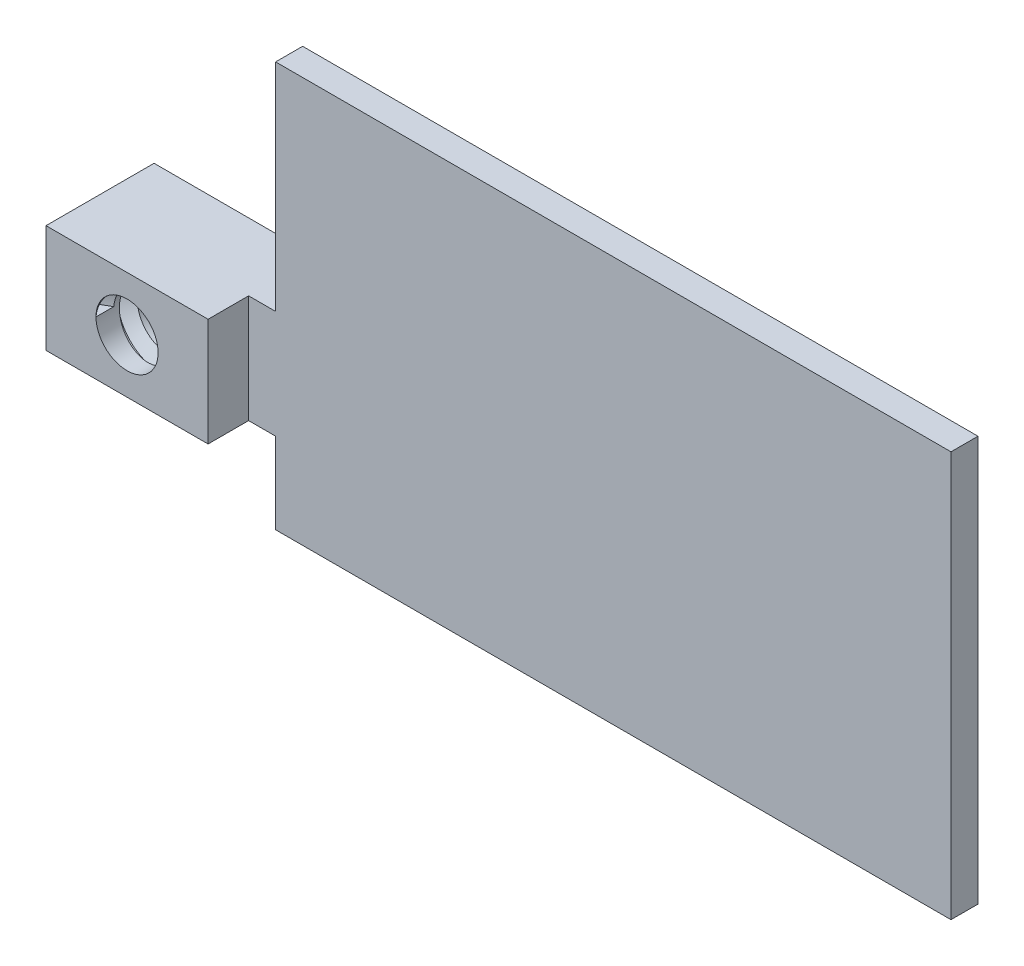
from build123d import *
from build123d.topology import SkipClean

# Parameters (mm, degrees)
BOSS_EXTRUDE1_DEPTH      = 2
BOSS_EXTRUDE2_DEPTH      = 3
BOSS_EXTRUDE2_DEPTH_BACK = 5
SKETCH2_W                = 12
SKETCH2_H                = 8
SKETCH3_R                = 2.3
CUT_EXTRUDE1_DEPTH       = 43.544094772
THREAD1_PITCH            = 1.75


with BuildPart() as part:
    # Sketch1 → Boss-Extrude1 (new body)
    with BuildSketch(Plane.XY):
        Polygon((-25, -15), (-25, -9), (-39, -9), (-39, -1), (-25, -1), (-25, 15), (25, 15), (25, -15), align=None)
    extrude(amount=BOSS_EXTRUDE1_DEPTH)

    # Sketch2 → Boss-Extrude2 (add, two sides: drawn at the far end of the back side and taken through both)
    with BuildSketch(Plane.XY.offset(2).offset(-BOSS_EXTRUDE2_DEPTH_BACK)):
        with Locations((-33, -5)):
            Rectangle(SKETCH2_W, SKETCH2_H)
    extrude(amount=BOSS_EXTRUDE2_DEPTH + BOSS_EXTRUDE2_DEPTH_BACK)

    # Sketch3 → Cut-Extrude1 (cut, through all)
    with BuildSketch(Plane.XY.offset(5)):
        with Locations((-33, -5)):
            Circle(SKETCH3_R)
    extrude(amount=-CUT_EXTRUDE1_DEPTH, mode=Mode.SUBTRACT)

    # Thread1: the profile of Thread Profile4 profile screwed along a right-hand helix of 4.571429 turns, 10 arcs to a turn; built about Z, then put on its axis
    with SkipClean():  # the faces are left unmerged after this step: merging them gives an invalid solid
        thread1_z = Axis((0, 0, 0), (0, 0, 1))
        thread1_corners = [(2.2997, 0, -0.000173205), (3.247215281, 0, 0.546874998), (3.247215281, 0, 0.765624998), (2.2997, 0, 1.3126732)]
        with BuildLine(mode=Mode.PRIVATE) as thread1_profile:
            Line(thread1_corners[0], thread1_corners[1])
            Line(thread1_corners[1], thread1_corners[2])
            Line(thread1_corners[2], thread1_corners[3])
            Line(thread1_corners[3], thread1_corners[0])
        thread1_cap = Face(thread1_profile.wire())
        thread1_turn_angles = [0, 18, 36, 54, 72, 90, 108, 126, 144, 162, 180, 198, 216, 234, 252, 270, 288, 306, 324, 342, 360]
        thread1_turn_weights = [1, 0.9510565162951535, 1, 0.9510565162951535, 1, 0.9510565162951535, 1, 0.9510565162951535, 1, 0.9510565162951535, 1, 0.9510565162951535, 1, 0.9510565162951535, 1, 0.9510565162951535, 1, 0.9510565162951535, 1, 0.9510565162951535, 1]
        thread1_turn_rails = [Edge.make_bspline([Vector(p[0], p[1], 0).rotate(thread1_z, thread1_turn_angles[k]) / thread1_turn_weights[k] + Vector(0, 0, p[2] + THREAD1_PITCH * thread1_turn_angles[k] / 360) for k in range(21)], [0, 0, 0, 1, 1, 2, 2, 3, 3, 4, 4, 5, 5, 6, 6, 7, 7, 8, 8, 9, 9, 10, 10, 10], 2, thread1_turn_weights) for p in thread1_corners]
        thread1_turn_sides = [Face.make_surface_from_curves(thread1_turn_rails[p[0]], thread1_turn_rails[p[1]]) for p in [(0, 1), (1, 2), (2, 3), (3, 0)]]
        thread1_last_angles = [1440, 1458, 1476, 1494, 1512, 1530, 1548, 1566, 1584, 1602, 1620, 1632.857142857, 1645.714285714]
        thread1_last_weights = [1, 0.9510565162951535, 1, 0.9510565162951535, 1, 0.9510565162951535, 1, 0.9510565162951535, 1, 0.9510565162951535, 1, 0.9749279121818235, 1]
        thread1_last_rails = [Edge.make_bspline([Vector(p[0], p[1], 0).rotate(thread1_z, thread1_last_angles[k]) / thread1_last_weights[k] + Vector(0, 0, p[2] + THREAD1_PITCH * thread1_last_angles[k] / 360) for k in range(13)], [0, 0, 0, 1, 1, 2, 2, 3, 3, 4, 4, 5, 5, 6, 6, 6], 2, thread1_last_weights) for p in thread1_corners]
        thread1_last_sides = [Face.make_surface_from_curves(thread1_last_rails[p[0]], thread1_last_rails[p[1]]) for p in [(0, 1), (1, 2), (2, 3), (3, 0)]]
        thread1 = Plane(origin=(-33, -5, 5), x_dir=(-1, 0, 0), z_dir=(0, 0, -1)) * Solid(Shell([*[p.moved(Location((0, 0, THREAD1_PITCH * i))) for i in range(4) for p in thread1_turn_sides], *thread1_last_sides, thread1_cap, thread1_cap.rotate(thread1_z, 1645.714285714).moved(Location((0, 0, THREAD1_PITCH * 1645.714285714 / 360)))]))
        add(thread1, mode=Mode.SUBTRACT)


solid = part.part
